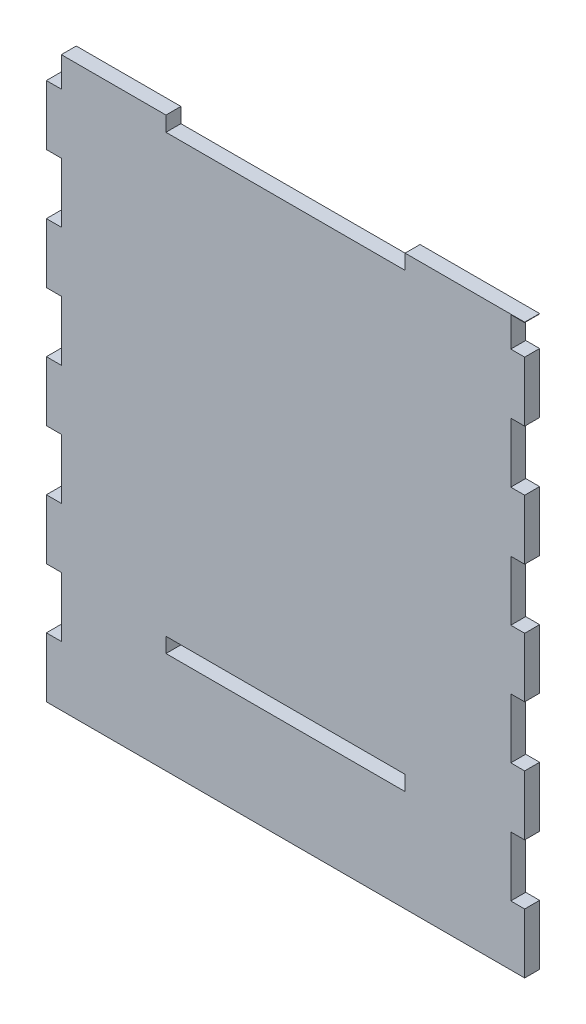
from build123d import *

# Parameters (mm, degrees)
SKETCH1_W           = 203.2
SKETCH1_H           = 241.3
BOSS_EXTRUDE1_DEPTH = 6.35
SKETCH2_W           = 6.35
SKETCH2_H           = 25.4
SKETCH2_H_2         = 12.7
CUT_EXTRUDE2_DEPTH  = 7.62
SKETCH3_W           = 101.6
SKETCH3_H           = 6.35
CUT_EXTRUDE3_DEPTH  = 6.35
SKETCH4_W           = 101.6
SKETCH4_H           = 6.35
CUT_EXTRUDE4_DEPTH  = 238.326076731


with BuildPart() as part:
    # Sketch1 → Boss-Extrude1 (new body)
    with BuildSketch(Plane.XY):
        with Locations((-101.068226601, -2.674507389)):
            Rectangle(SKETCH1_W, SKETCH1_H)
    extrude(amount=BOSS_EXTRUDE1_DEPTH)

    # Sketch2 → Cut-Extrude2 (cut)
    with BuildSketch(Plane.XY.offset(6.35)):
        with Locations((-199.493226601, -85.224507389)):
            Rectangle(SKETCH2_W, SKETCH2_H)
        with Locations((-199.493226601, -34.424507389)):
            Rectangle(SKETCH2_W, SKETCH2_H)
        with Locations((-199.493226601, 16.375492611)):
            Rectangle(SKETCH2_W, SKETCH2_H)
        with Locations((-199.493226601, 67.175492611)):
            Rectangle(SKETCH2_W, SKETCH2_H)
        with Locations((-199.493226601, 111.625492611)):
            Rectangle(SKETCH2_W, SKETCH2_H_2)
        with Locations((-2.202282379, -85.224507389)):
            Rectangle(SKETCH2_W, SKETCH2_H)
        with Locations((-2.202282379, -34.424507389)):
            Rectangle(SKETCH2_W, SKETCH2_H)
        with Locations((-2.202282379, 16.208154802)):
            Rectangle(SKETCH2_W, SKETCH2_H)
        with Locations((-2.202282379, 67.008154802)):
            Rectangle(SKETCH2_W, SKETCH2_H)
        with Locations((-2.202282379, 111.458154802)):
            Rectangle(SKETCH2_W, SKETCH2_H_2)
    extrude(amount=-CUT_EXTRUDE2_DEPTH, mode=Mode.SUBTRACT)

    # Sketch3 → Cut-Extrude3 (cut)
    with BuildSketch(Plane(origin=(0, 117.975492611, 0), x_dir=(1, 0, 0), z_dir=(0, 1, 0))):
        with Locations((-101.068226601, -3.175)):
            Rectangle(SKETCH3_W, SKETCH3_H)
    extrude(amount=-CUT_EXTRUDE3_DEPTH, mode=Mode.SUBTRACT)

    # Sketch4 → Cut-Extrude4 (cut, through all)
    with BuildSketch(Plane.XY.offset(6.35)):
        with Locations((-101.068226601, -76.969507389)):
            Rectangle(SKETCH4_W, SKETCH4_H)
    extrude(amount=-CUT_EXTRUDE4_DEPTH, mode=Mode.SUBTRACT)


solid = part.part
